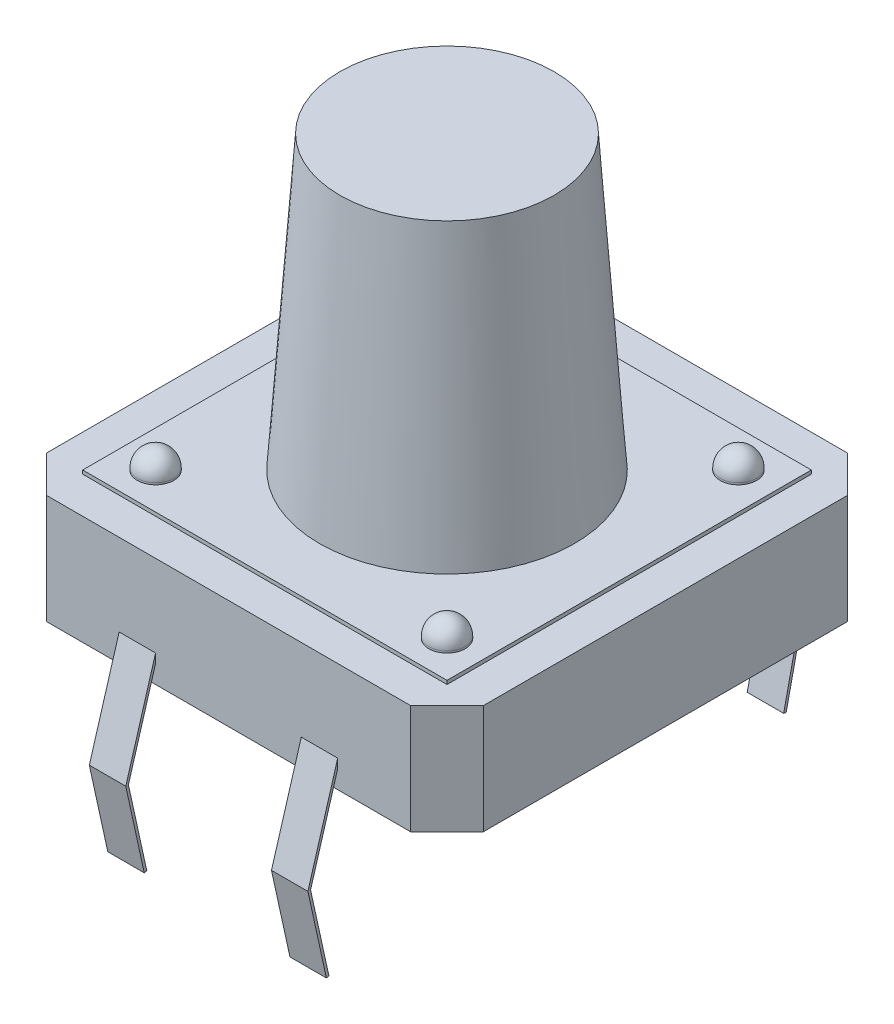
from build123d import *

# Parameters (mm, degrees)
SKETCH1_W            = 12
SKETCH1_H            = 12
BOSS_EXTRUDE1_DEPTH  = 3
CHAMFER1_SIZE        = 1
SKETCH2_W            = 10
SKETCH2_H            = 10
BOSS_EXTRUDE2_DEPTH  = 0.1
SKETCH3_R            = 0.5
BOSS_EXTRUDE3_DEPTH  = 0.05
LPATTERN1_COUNT      = 2
LPATTERN1_PITCH      = 8
LPATTERN1_COUNT_DIR2 = 2
LPATTERN1_PITCH_DIR2 = 8
SKETCH4_R            = 3.5
BOSS_EXTRUDE4_DEPTH  = 8
BOSS_EXTRUDE4_TAPER  = 4
SWEEP1_START         = -3
SWEEP1_DEPTH         = 1
SWEEP1_START_2       = 2
SWEEP1_2_DEPTH       = 1


# Read off the part's stored shape, not the designer's step: Dome1, Sweep1
with BuildPart() as part:
    # Sketch1 → Boss-Extrude1 (new body)
    with BuildSketch(Plane(origin=(0, 0, 0), x_dir=(1, 0, 0), z_dir=(0, 1, 0))):
        Rectangle(SKETCH1_W, SKETCH1_H)
    extrude(amount=BOSS_EXTRUDE1_DEPTH)

    # Chamfer1
    chamfer1_edges = [part.edges().sort_by_distance(p)[0] for p in [
        (6, 1.5, 6),
        (-6, 1.5, 6),
        (-6, 1.5, -6),
        (6, 1.5, -6),
    ]]
    chamfer(chamfer1_edges, length=CHAMFER1_SIZE)

    # Sketch2 → Boss-Extrude2 (add)
    with BuildSketch(Plane(origin=(0, 3, 0), x_dir=(1, 0, 0), z_dir=(0, 1, 0))):
        Rectangle(SKETCH2_W, SKETCH2_H)
    extrude(amount=BOSS_EXTRUDE2_DEPTH)

    # Sketch3 → Boss-Extrude3 (add)
    with BuildSketch(Plane(origin=(0, 3.1, 0), x_dir=(1, 0, 0), z_dir=(0, 1, 0))):
        with Locations(Location((-4, 4, 0), (0, 0, 270))):
            Circle(SKETCH3_R)
    boss_extrude3 = extrude(amount=BOSS_EXTRUDE3_DEPTH)

    # Dome1 outline → Dome1 (revolve)
    with BuildSketch(Plane(origin=(-4, 0, -4), x_dir=(1, 0, 0), z_dir=(0, 0, 1))):
        with BuildLine():
            Line((0, 3.15), (0.5, 3.149999999))
            ThreePointArc((0.5, 3.149999999), (0.353553391, 3.50355339), (0, 3.65))
            Line((0, 3.65), (0, 3.15))
        make_face()
    dome1 = revolve(axis=Axis((-4, 0, -4), (0, 1, 0)))

    # LPattern1: Boss-Extrude3, Dome1 2 × 2
    with Locations(*[(i * LPATTERN1_PITCH, 0, j * LPATTERN1_PITCH_DIR2) for i in range(LPATTERN1_COUNT) for j in range(LPATTERN1_COUNT_DIR2) if (i, j) != (0, 0)]):
        add(boss_extrude3)
        add(dome1)

    # Sketch4 → Boss-Extrude4 (add)
    with BuildSketch(Plane(origin=(0, 3.1, 0), x_dir=(1, 0, 0), z_dir=(0, 1, 0))):
        Circle(SKETCH4_R)
    extrude(amount=BOSS_EXTRUDE4_DEPTH, taper=BOSS_EXTRUDE4_TAPER)

    # Sweep1 outline → Sweep1 (add)
    with BuildSketch(Plane.YZ.offset(SWEEP1_START)):
        Polygon((0.75, 6), (-2.007966225, 6.818182656), (-4.321335721, 6.310463619), (-4.306093498, 6.241014001), (-2.010621634, 6.744805015), (0.5, 6), align=None)
    sweep1 = extrude(amount=SWEEP1_DEPTH)

    # Sweep1 2 outline → Sweep1 2 (add)
    with BuildSketch(Plane.YZ.offset(SWEEP1_START_2)):
        Polygon((0.75, 6), (-2.007966225, 6.818182656), (-4.321335721, 6.310463619), (-4.306093498, 6.241014001), (-2.010621634, 6.744805015), (0.5, 6), align=None)
    sweep1_2 = extrude(amount=SWEEP1_2_DEPTH)

    # Mirror1: Sweep1, Sweep1 2 across plane
    add(sweep1.mirror(Plane.XY))
    add(sweep1_2.mirror(Plane.XY))


solid = part.part
